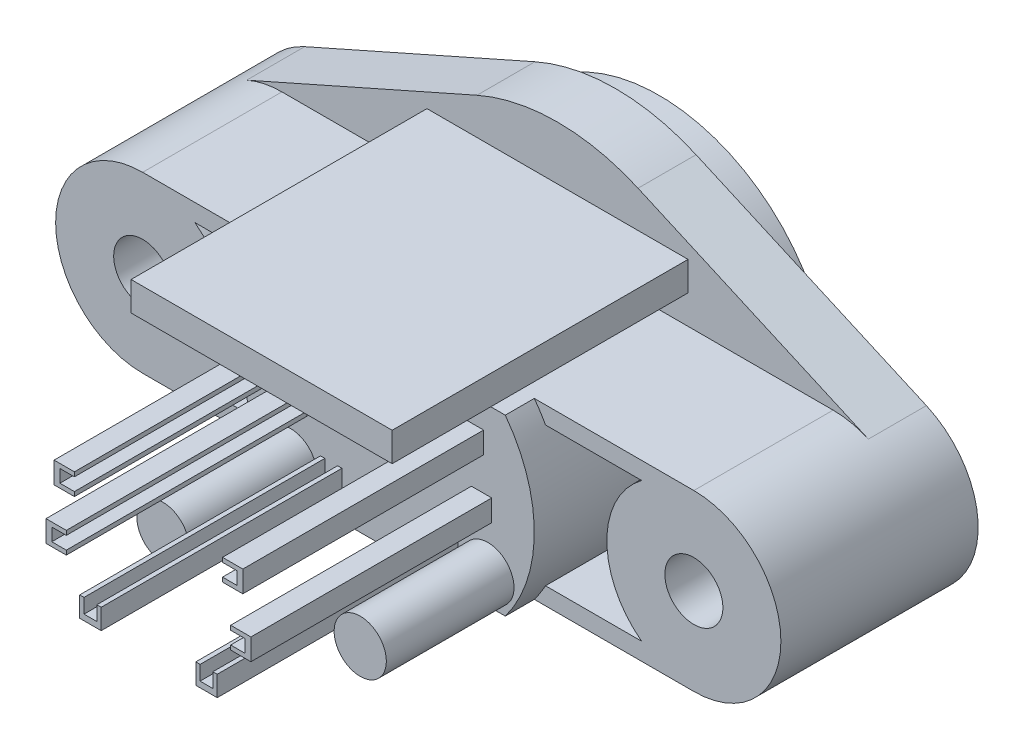
from build123d import *
from build123d.topology import SkipClean

# Parameters (mm, degrees)
BASEBODY_DEPTH           = 2
SKETCH_2_R               = 5.9
FRONTBODY_DEPTH          = 1.5
SOCKET_START             = -1.5
SOCKET_DEPTH             = 1.5
SKETCH_3_3_R             = 0.75
SOCKETPINS_DEPTH         = 1.5
SKETCH_4_R               = 5
RBODY_DEPTH              = 4.8
SKETCH_5_R               = 1.4
HOLE1_DEPTH              = 2
SKETCH_5_3_R             = 1
HOLE2_DEPTH              = 16.792798992
LIGHTING_START           = -6
LIGHTING_DEPTH           = 6
SKETCH_7_R               = 5
RBODY2_DEPTH             = 1
LIGHTING3_DEPTH          = 17.248461466
LIGHTING3_DEPTH_BACK     = 17.248461466
SKETCH_8_W               = 3.4
SKETCH_8_H               = 2
CUT_EXTRUDE_8_DEPTH      = 17.248461466
CUT_EXTRUDE_8_DEPTH_BACK = 17.248461466
SKETCH_9_W               = 5.8
SKETCH_9_H               = 2
SKETCH_10_W              = 5.7
SKETCH_10_H              = 1
EXTRUDE_2_DEPTH          = 4
EXTRUDE_3_DEPTH          = 10.2
SKETCH_11_R              = 0.9
EXTRUDE_4_DEPTH          = 4.4
EXTRUDE_5_DEPTH          = 8.3


# Read off the part's stored shape, not the designer's step: Socket
with BuildPart() as part:
    # Эскиз1 → BaseBody (new body)
    with BuildSketch(Plane.XY):
        with BuildLine():
            Line((-10.715789474, 2.742600218), (-2.776052632, 6.262270498))
            ThreePointArc((-2.776052632, 6.262270498), (0, 6.85), (2.776052632, 6.262270498))
            Line((2.776052632, 6.262270498), (10.715789474, 2.742600218))
            ThreePointArc((10.715789474, 2.742600218), (12.5, 0), (10.715789474, -2.742600218))
            Line((10.715789474, -2.742600218), (2.776052632, -6.262270498))
            ThreePointArc((2.776052632, -6.262270498), (0, -6.85), (-2.776052632, -6.262270498))
            Line((-2.776052632, -6.262270498), (-10.715789474, -2.742600218))
            ThreePointArc((-10.715789474, -2.742600218), (-12.5, 0), (-10.715789474, 2.742600218))
        make_face()
    extrude(amount=BASEBODY_DEPTH)

    # Эскиз2 → FrontBody (add)
    with BuildSketch(Plane(origin=(0, 0, 0), x_dir=(-1, 0, 0), z_dir=(0, 0, -1))):
        Circle(SKETCH_2_R)
    extrude(amount=FRONTBODY_DEPTH)

    # Socket outline → Socket (cut)
    with BuildSketch(Plane(origin=(0, 0, -1.5), x_dir=(-1, 0, 0), z_dir=(0, 0, -1)).offset(SOCKET_START)):
        with BuildLine():
            Line((-2, 4.85412196), (-2, 4.363484846))
            ThreePointArc((-2, 4.363484846), (0, -4.8), (2, 4.363484846))
            Line((2, 4.363484846), (2, 4.85412196))
            ThreePointArc((2, 4.85412196), (0, 5.25), (-2, 4.85412196))
        make_face()
        with BuildLine():
            ThreePointArc((-3.567912555, -2.4), (-3.947776364, 1.704424179), (-0.7, 4.242640687))
            Line((-0.7, 4.242640687), (-0.7, 3.542640687))
            Line((-0.7, 3.542640687), (0.7, 3.542640687))
            Line((0.7, 3.542640687), (0.7, 4.242640687))
            ThreePointArc((0.7, 4.242640687), (3.947776364, 1.704424179), (3.567912555, -2.4))
            Line((3.567912555, -2.4), (2.5, -2.4))
            Line((2.5, -2.4), (2.5, -3.498571137))
            ThreePointArc((2.5, -3.498571137), (0, -4.3), (-2.5, -3.498571137))
            Line((-2.5, -3.498571137), (-2.5, -2.4))
            Line((-2.5, -2.4), (-3.567912555, -2.4))
        make_face(mode=Mode.SUBTRACT)
    extrude(amount=SOCKET_DEPTH, mode=Mode.SUBTRACT)

    # Эскиз3<3> → SocketPins (cut)
    with BuildSketch(Plane(origin=(0, 0, -1.5), x_dir=(-1, 0, 0), z_dir=(0, 0, -1))):
        with Locations((-2, 1.6)):
            Circle(SKETCH_3_3_R)
        with Locations((-2.5, -0.4)):
            Circle(SKETCH_3_3_R)
        with Locations((-1, -2.4)):
            Circle(SKETCH_3_3_R)
        with Locations((1, -2.4)):
            Circle(SKETCH_3_3_R)
        with Locations((2.5, -0.4)):
            Circle(SKETCH_3_3_R)
        with Locations((2, 1.6)):
            Circle(SKETCH_3_3_R)
    extrude(amount=-SOCKETPINS_DEPTH, mode=Mode.SUBTRACT)

    # Эскиз4 → RBody (add)
    with SkipClean():  # the faces are left unmerged after this step: merging them gives an invalid solid
        with BuildSketch(Plane.XY.offset(2)):
            with BuildLine():
                ThreePointArc((-6.5, 0), (-7.378679656, 2.121320344), (-9.5, 3))
                ThreePointArc((-9.5, 3), (-10.121369192, 2.934944689), (-10.715789474, 2.742600218))
                ThreePointArc((-10.715789474, 2.742600218), (-12.5, 0), (-10.715789474, -2.742600218))
                ThreePointArc((-10.715789474, -2.742600218), (-10.121369192, -2.934944689), (-9.5, -3))
                ThreePointArc((-9.5, -3), (-7.378679656, -2.121320344), (-6.5, 0))
            make_face()
            with BuildLine():
                Line((-4, 3), (-9.5, 3))
                ThreePointArc((-9.5, 3), (-7.378679656, 2.121320344), (-6.5, 0))
                ThreePointArc((-6.5, 0), (-7.378679656, -2.121320344), (-9.5, -3))
                Line((-9.5, -3), (-4, -3))
                ThreePointArc((-4, -3), (-5, 0), (-4, 3))
            make_face()
            Circle(SKETCH_4_R)
            with BuildLine():
                Line((9.5, 3), (4, 3))
                ThreePointArc((4, 3), (4.74341649, 1.58113883), (5, 0))
                ThreePointArc((5, 0), (4.74341649, -1.58113883), (4, -3))
                Line((4, -3), (9.5, -3))
                ThreePointArc((9.5, -3), (6.5, 0), (9.5, 3))
            make_face()
            with BuildLine():
                ThreePointArc((10.715789474, 2.742600218), (10.121369192, 2.934944689), (9.5, 3))
                ThreePointArc((9.5, 3), (6.5, 0), (9.5, -3))
                ThreePointArc((9.5, -3), (10.121369192, -2.934944689), (10.715789474, -2.742600218))
                ThreePointArc((10.715789474, -2.742600218), (12.014693661, -1.635944923), (12.5, 0))
                ThreePointArc((12.5, 0), (12.014693661, 1.635944923), (10.715789474, 2.742600218))
            make_face()
        extrude(amount=RBODY_DEPTH)

    # Эскиз5 → Hole1 (cut)
    with SkipClean():  # the faces are left unmerged after this step: merging them gives an invalid solid
        with BuildSketch(Plane(origin=(0, 0, 0), x_dir=(-1, 0, 0), z_dir=(0, 0, -1))):
            with Locations((9.5, 0)):
                Circle(SKETCH_5_R)
            with Locations((-9.5, 0)):
                Circle(SKETCH_5_R)
        extrude(amount=-HOLE1_DEPTH, mode=Mode.SUBTRACT)

    # Эскиз5<3> → Hole2 (cut, through all)
    with SkipClean():  # the faces are left unmerged after this step: merging them gives an invalid solid
        with BuildSketch(Plane(origin=(0, 0, 0), x_dir=(-1, 0, 0), z_dir=(0, 0, -1))):
            with Locations((9.5, 0)):
                Circle(SKETCH_5_3_R)
            with Locations((-9.5, 0)):
                Circle(SKETCH_5_3_R)
        extrude(amount=-HOLE2_DEPTH, mode=Mode.SUBTRACT)

    # Эскиз6 → Lighting (cut)
    with SkipClean():  # the faces are left unmerged after this step: merging them gives an invalid solid
        with BuildSketch(Plane.XY.offset(6.8).offset(LIGHTING_START)):
            with BuildLine():
                Line((-7.7, 2.4), (-4.38634244, 2.4))
                ThreePointArc((-4.38634244, 2.4), (-5, 0), (-4.38634244, -2.4))
                Line((-4.38634244, -2.4), (-7.7, -2.4))
                ThreePointArc((-7.7, -2.4), (-6.5, 0), (-7.7, 2.4))
            make_face()
        lighting = extrude(amount=LIGHTING_DEPTH, mode=Mode.SUBTRACT)

    # Lighting2: Lighting across plane
    with SkipClean():  # the faces are left unmerged after this step: merging them gives an invalid solid
        add(lighting.mirror(Plane(origin=(0, 0, 0), x_dir=(0, 0, 1), z_dir=(1, 0, 0))), mode=Mode.SUBTRACT)

    # Эскиз7 → RBody2 (add)
    with SkipClean():  # the faces are left unmerged after this step: merging them gives an invalid solid
        with BuildSketch(Plane.XY.offset(6.8)):
            with Locations(Location((0, 0, 0), (0, 0, 151.314597986))):
                Circle(SKETCH_7_R)
        extrude(amount=RBODY2_DEPTH)

    # Эскиз8 → Lighting3 (cut, two sides: drawn at the far end of the back side and taken through both)
    with SkipClean():  # the faces are left unmerged after this step: merging them gives an invalid solid
        with BuildSketch(Plane(origin=(0, 0, 0), x_dir=(0, 0, -1), z_dir=(1, 0, 0)).offset(-LIGHTING3_DEPTH_BACK)):
            with Locations((-6.1, -4)):
                Rectangle(SKETCH_8_W, SKETCH_8_H)
        extrude(amount=LIGHTING3_DEPTH + LIGHTING3_DEPTH_BACK, mode=Mode.SUBTRACT)

    # Эскиз9 → Вырез-Вытянуть8 (cut, two sides: drawn at the far end of the back side and taken through both)
    with SkipClean():  # the faces are left unmerged after this step: merging them gives an invalid solid
        with BuildSketch(Plane(origin=(0, 0, 0), x_dir=(0, 0, -1), z_dir=(1, 0, 0)).offset(-CUT_EXTRUDE_8_DEPTH_BACK)):
            with Locations((-4.9, 4)):
                Rectangle(SKETCH_9_W, SKETCH_9_H)
        extrude(amount=CUT_EXTRUDE_8_DEPTH + CUT_EXTRUDE_8_DEPTH_BACK, mode=Mode.SUBTRACT)

    # Эскиз10 → Бобышка-Вытянуть2 (add)
    with SkipClean():  # the faces are left unmerged after this step: merging them gives an invalid solid
        with BuildSketch(Plane.XY.offset(2)):
            with Locations((0, 3.5)):
                Rectangle(SKETCH_10_W, SKETCH_10_H)
        extrude(amount=EXTRUDE_2_DEPTH)

    # Эскиз10<3> → Бобышка-Вытянуть3 (add)
    with SkipClean():  # the faces are left unmerged after this step: merging them gives an invalid solid
        with BuildSketch(Plane.XY.offset(2)):
            Polygon((-4.5, 4), (-2.85, 4), (2.85, 4), (4.5, 4), (4.5, 5), (-4.5, 5), align=None)
        extrude(amount=EXTRUDE_3_DEPTH)

    # Эскиз11 → Бобышка-Вытянуть4 (add)
    with SkipClean():  # the faces are left unmerged after this step: merging them gives an invalid solid
        with BuildSketch(Plane.XY.offset(7.8)):
            with Locations((-3.4, -2)):
                Circle(SKETCH_11_R)
            with Locations((3.4, -2)):
                Circle(SKETCH_11_R)
        extrude(amount=EXTRUDE_4_DEPTH)

    # Эскиз12 → Бобышка-Вытянуть5 (add)
    with SkipClean():  # the faces are left unmerged after this step: merging them gives an invalid solid
        with BuildSketch(Plane.XY.offset(7.8)):
            Polygon((1.63, -1.4), (1.63, -2.1), (2.37, -2.1), (2.37, -1.4), (2.22, -1.4), (2.22, -1.9), (1.78, -1.9), (1.78, -1.4), align=None)
            Polygon((2.832000989, -0.445092269), (3.532000989, -0.445092269), (3.532000989, 0.294907731), (2.832000989, 0.294907731), (2.832000989, 0.144907731), (3.332000989, 0.144907731), (3.332000989, -0.295092269), (2.832000989, -0.295092269), align=None)
            Polygon((2.552578831, 1.441994282), (3.252578831, 1.441994282), (3.252578831, 2.181994282), (2.552578831, 2.181994282), (2.552578831, 2.031994282), (3.052578831, 2.031994282), (3.052578831, 1.591994282), (2.552578831, 1.591994282), align=None)
        extrude_5 = extrude(amount=EXTRUDE_5_DEPTH)

    # Зеркальное отражение3: Бобышка-Вытянуть5 across plane
    with SkipClean():  # the faces are left unmerged after this step: merging them gives an invalid solid
        add(extrude_5.mirror(Plane(origin=(0, 0, 0), x_dir=(0, 0, 1), z_dir=(1, 0, 0))))


solid = part.part
